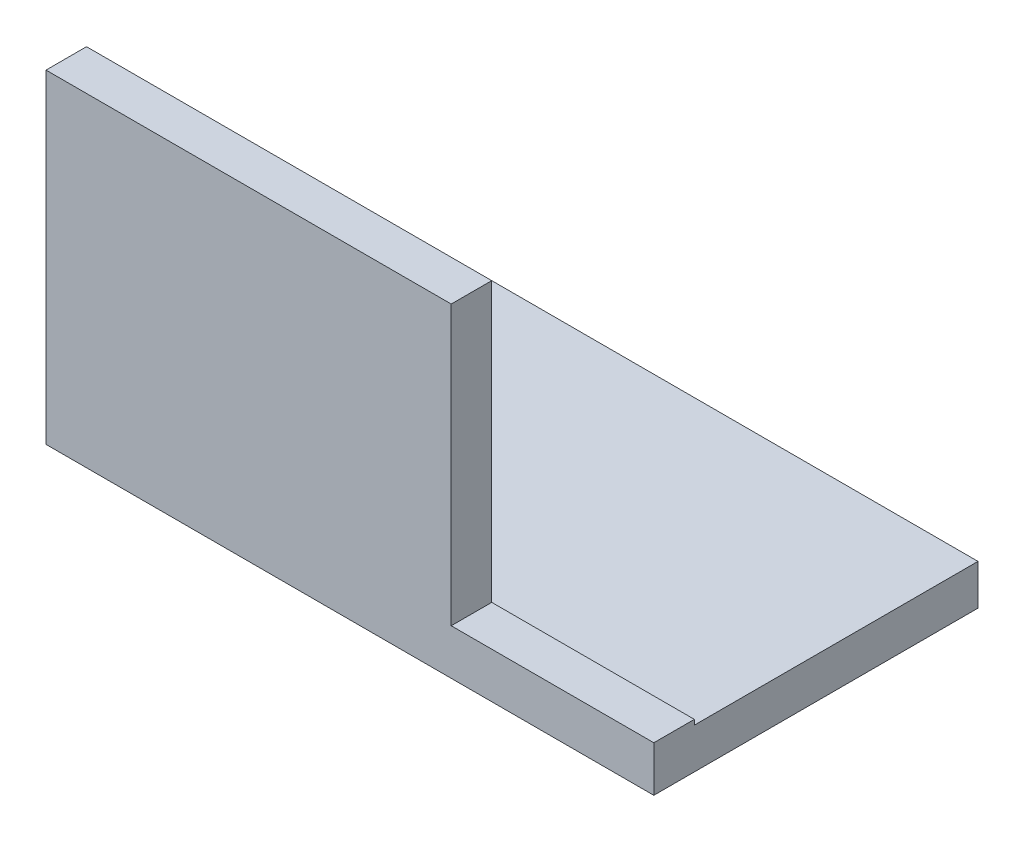
from build123d import *

# Parameters (mm, degrees)
EXTRUDE_1_DEPTH     = 60
SKETCH_2_W          = 20
SKETCH_2_H          = 27.504930687
CUT_EXTRUDE_1_DEPTH = 76.153176912


with BuildPart() as part:
    # Эскиз1 → Вытянуть-Тонкостенный1 (new body)
    with BuildSketch(Plane(origin=(0, 0, 0), x_dir=(0, 0, -1), z_dir=(1, 0, 0))):
        Polygon((0, 32), (0, 0), (32, 0), (32, 4), (4, 4), (4, 32), align=None)
    extrude(amount=EXTRUDE_1_DEPTH)

    # Эскиз2 → Вырез-Вытянуть1 (cut, through all)
    with BuildSketch(Plane.XY):
        with Locations((50, 18.247534657)):
            Rectangle(SKETCH_2_W, SKETCH_2_H)
    extrude(amount=-CUT_EXTRUDE_1_DEPTH, mode=Mode.SUBTRACT)


solid = part.part
